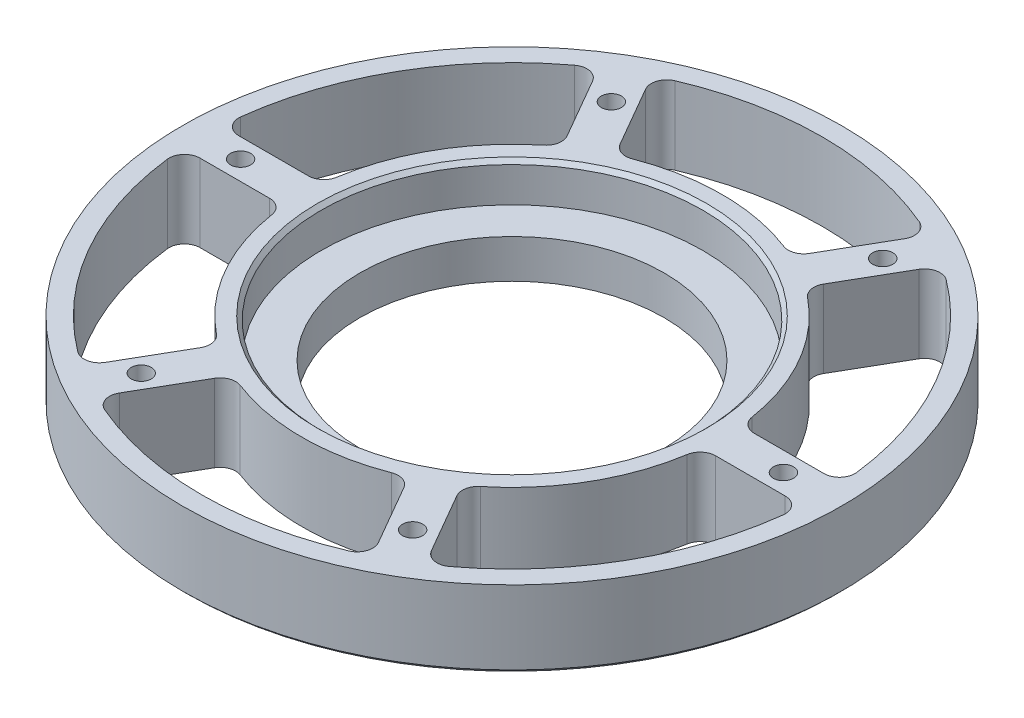
from build123d import *

# Parameters (mm, degrees)
F_6_0_204_DIAMETER_HOLE1_D = 5.1816
CIRPATTERN3_COUNT          = 6
CUT_EXTRUDE1_DEPTH         = 122.86033891327318
FILLET1_R                  = 4
CIRPATTERN4_COUNT          = 6
FILLET1_OF_CIRPATTERN4_R   = 4
CHAMFER1_SIZE              = 1
CHAMFER2_SIZE              = 1


with BuildPart() as part:
    # Sketch2 → Revolve1 (revolve)
    with BuildSketch(Plane(origin=(0, 0, 0), x_dir=(0, 0, -1), z_dir=(1, 0, 0))):
        Polygon((-39.2125, -8.7e-16), (-84.99983, -5.61e-15), (-84.99983, 19.999999999999993), (-49.2125, 19.999999999999993), (-49.21250000000001, 9.999999999999993), (-39.21250000000001, 9.999999999999991), align=None)
    revolve(axis=Axis((0, -1.000000000000006, 0), (0, 1, 0)))

    # #6 (0.204) Diameter Hole1 (through all)
    with Locations(Plane(origin=(0, 19.999999999999993, 0), x_dir=(1, 0, 0), z_dir=(0, 1, 0))):
        with Locations((-35, 60.621778265)):
            f_6_0_204_diameter_hole1 = Hole(F_6_0_204_DIAMETER_HOLE1_D / 2)

    # CirPattern3: #6 (0.204) Diameter Hole1 ×6 about axis
    cirpattern3_axis = Axis((0, -1.000000000000006, 0), (0, 1, 0))
    for i in range(1, CIRPATTERN3_COUNT):
        add(f_6_0_204_diameter_hole1.rotate(cirpattern3_axis, i * 360 / CIRPATTERN3_COUNT), mode=Mode.SUBTRACT)

    # Sketch8 → Cut-Extrude1 (cut, through all)
    with BuildSketch(Plane(origin=(0, 19.999999999999993, 0), x_dir=(1, 0, 0), z_dir=(0, 1, 0))):
        with BuildLine():
            Line((-35.59158637125224, 71.64643591698466), (-22.660589701137393, 49.249292691841845))
            ThreePointArc((-22.660589701137393, 49.249292691841845), (3.32e-15, 54.212500000000006), (22.660589701137393, 49.249292691841845))
            Line((22.660589701137393, 49.249292691841845), (35.59158637125224, 71.64643591698466))
            ThreePointArc((35.59158637125224, 71.64643591698466), (4.9e-15, 79.99982999999999), (-35.59158637125224, 71.64643591698466))
        make_face()
    cut_extrude1 = extrude(amount=-CUT_EXTRUDE1_DEPTH, mode=Mode.SUBTRACT)

    # Fillet1
    fillet1_edges = [part.edges().sort_by_distance(p)[0] for p in [
        (35.59158637125225, 9.999999999999996, -71.64643591698467),
        (22.660589701137397, 9.999999999999996, -49.249292691841845),
        (-35.591586371252234, 9.999999999999996, -71.64643591698467),
        (-22.660589701137393, 9.999999999999996, -49.249292691841845),
    ]]
    fillet(fillet1_edges, radius=FILLET1_R)

    # CirPattern4: Cut-Extrude1 ×6 about axis
    cirpattern4_axis = Axis((0, -1.000000000000006, 0), (0, 1, 0))
    for i in range(1, CIRPATTERN4_COUNT):
        add(cut_extrude1.rotate(cirpattern4_axis, i * 360 / CIRPATTERN4_COUNT), mode=Mode.SUBTRACT)

    # Fillet1 of CirPattern4
    fillet1_of_cirpattern4_edges = [part.edges().sort_by_distance(p)[0] for p in [
        (-44.25184040909643, 9.999999999999996, -66.64643591698479),
        (-31.320843738981637, 9.999999999999996, -44.24929269184193),
        (-79.84342678034868, 9.999999999999996, -4.999999999999904),
        (-53.981433440119034, 9.999999999999996, -4.999999999999929),
        (-79.84342678034868, 9.999999999999996, 4.9999999999998685),
        (-53.981433440119034, 9.999999999999996, 4.999999999999904),
        (-44.25184040909645, 9.999999999999996, 66.64643591698476),
        (-31.32084373898165, 9.999999999999996, 44.249292691841916),
        (-35.591586371252255, 9.999999999999996, 71.64643591698467),
        (-22.660589701137404, 9.999999999999996, 49.249292691841845),
        (35.59158637125223, 9.999999999999996, 71.64643591698467),
        (22.660589701137386, 9.999999999999996, 49.249292691841845),
        (44.2518404090964, 9.999999999999996, 66.64643591698481),
        (31.320843738981612, 9.999999999999996, 44.249292691841944),
        (79.84342678034866, 9.999999999999996, 4.999999999999936),
        (53.98143344011903, 9.999999999999996, 4.999999999999947),
        (79.84342678034868, 9.999999999999996, -4.999999999999893),
        (53.981433440119034, 9.999999999999996, -4.999999999999925),
        (44.25184040909643, 9.999999999999996, -66.64643591698479),
        (31.320843738981637, 9.999999999999996, -44.24929269184193),
    ]]
    fillet(fillet1_of_cirpattern4_edges, radius=FILLET1_OF_CIRPATTERN4_R)

    # Chamfer1
    chamfer1_edges = [part.edges().sort_by_distance(p)[0] for p in [
        (6.03e-15, 19.999999999999993, -49.2125),
    ]]
    chamfer(chamfer1_edges, length=CHAMFER1_SIZE)

    # Chamfer2
    chamfer2_edges = [part.edges().sort_by_distance(p)[0] for p in [
        (1.041e-14, -5.55e-15, -84.99983),
    ]]
    chamfer(chamfer2_edges, length=CHAMFER2_SIZE)


solid = part.part
